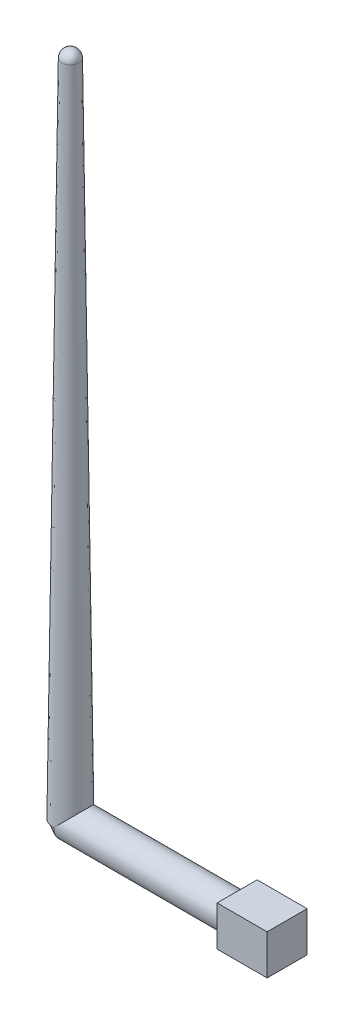
from build123d import *

# Parameters (mm, degrees)
FILLET1_R           = 2.54
SKETCH3_W           = 12
SKETCH3_H           = 12
BOSS_EXTRUDE1_DEPTH = 15
FILLET2_R           = 0.5


# Read off the part's stored shape, not the designer's step: Revolve2
with BuildPart() as part:
    # Sketch1 → Revolve1 (revolve)
    with BuildSketch(Plane.XY, mode=Mode.PRIVATE) as revolve1_sk:
        Polygon((-5, 0), (-2.54, 200), (0, 200), (0, 0), align=None)
    revolve(revolve1_sk.sketch.rotate(Axis((0, 92.12962963, 0), (0, -1, 0)), 270), axis=Axis((0, 92.12962963, 0), (0, -1, 0)))

    # Fillet1
    fillet1_edges = [part.edges().sort_by_distance(p)[0] for p in [
        (0, 200, -2.54),
    ]]
    fillet(fillet1_edges, radius=FILLET1_R)

    # Revolve2 outline → Revolve2 (revolve)
    with BuildSketch(Plane.YX):
        with BuildLine():
            Line((0, 50), (0, -5))
            add(Edge.make_bspline(
                [(5, 0), (3.754456839, -3.754456839), (0, -5)],
                knots=[0.320325383, 0.320325383, 0.320325383, 1.250470944, 1.250470944, 1.250470944], degree=2, weights=[1, 0.893788927, 1]))
            Line((5, 0), (5, 50))
            Line((5, 50), (0, 50))
        make_face()
    revolve(axis=Axis((0, 0, 0), (1, 0, 0)))

    # Sketch3 → Boss-Extrude1 (add)
    with BuildSketch(Plane(origin=(50, 0, 0), x_dir=(0, 0, -1), z_dir=(1, 0, 0))):
        Rectangle(SKETCH3_W, SKETCH3_H)
    extrude(amount=BOSS_EXTRUDE1_DEPTH)

    # Fillet2
    fillet2_edges = [part.edges().sort_by_distance(p)[0] for p in [
        (50, -5, 0),
    ]]
    fillet(fillet2_edges, radius=FILLET2_R)


solid = part.part
